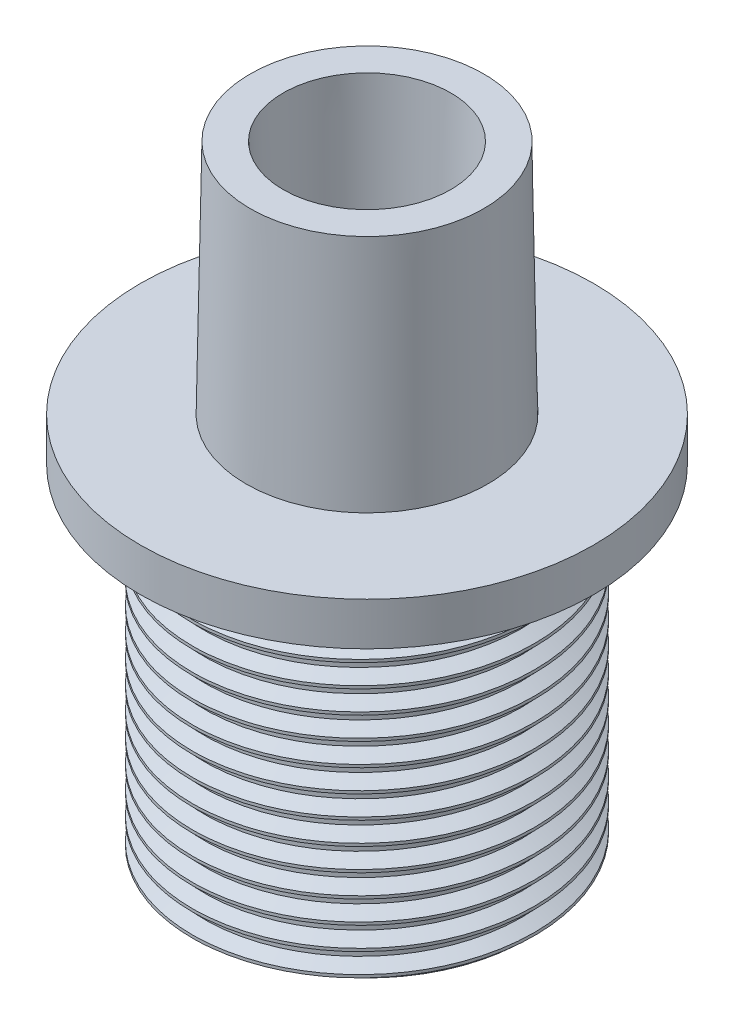
from build123d import *

# Parameters (mm, degrees)
SKETCH1_R           = 15.9
BOSS_EXTRUDE1_DEPTH = 35
SKETCH2_R           = 11.65
CUT_EXTRUDE1_DEPTH  = 25
BOSS_EXTRUDE2_START = -4
SKETCH5_R           = 21.087839895
SKETCH5_R_2         = 15.9
BOSS_EXTRUDE2_DEPTH = 4
THREAD1_PITCH       = 2.116666667
SKETCH3_R           = 11.25
BOSS_EXTRUDE3_DEPTH = 22
BOSS_EXTRUDE3_TAPER = 1
SKETCH7_R           = 7.8
CUT_EXTRUDE2_DEPTH  = 32
CUT_EXTRUDE2_DRAFT  = -1.5


with BuildPart() as part:
    # Sketch1 → Boss-Extrude1 (new body)
    with BuildSketch(Plane(origin=(0, 0, 0), x_dir=(1, 0, 0), z_dir=(0, 1, 0))):
        with Locations(Location((0, 0, 0), (0, 0, 270))):
            Circle(SKETCH1_R)
    extrude(amount=BOSS_EXTRUDE1_DEPTH)

    # Sketch2 → Cut-Extrude1 (cut)
    with BuildSketch(Plane.XZ):
        with Locations(Location((0, 0, 0), (0, 0, 270))):
            Circle(SKETCH2_R)
    extrude(amount=-CUT_EXTRUDE1_DEPTH, mode=Mode.SUBTRACT)

    # Sketch5 → Boss-Extrude2 (add)
    with BuildSketch(Plane(origin=(0, 35, 0), x_dir=(1, 0, 0), z_dir=(0, 1, 0)).offset(BOSS_EXTRUDE2_START)):
        with Locations(Location((0, 0, 0), (0, 0, 270))):
            Circle(SKETCH5_R)
        with Locations(Location((0, 0, 0), (0, 0, 270))):
            Circle(SKETCH5_R_2, mode=Mode.SUBTRACT)
    extrude(amount=BOSS_EXTRUDE2_DEPTH)

    # Thread1: the profile of Thread Profile1 profile screwed along a right-hand helix of 16.062992 turns, 10 arcs to a turn; built about Z, then put on its axis
    thread1_z = Axis((0, 0, 0), (0, 0, 1))
    thread1_corners = [(15.9003, 0, -0.000173205), (15.9003, 0, 1.852256533), (14.754320565, 0, 1.190624997), (14.754320565, 0, 0.66145833)]
    with BuildLine(mode=Mode.PRIVATE) as thread1_profile:
        Line(thread1_corners[0], thread1_corners[1])
        Line(thread1_corners[1], thread1_corners[2])
        Line(thread1_corners[2], thread1_corners[3])
        Line(thread1_corners[3], thread1_corners[0])
    thread1_cap = Face(thread1_profile.wire())
    thread1_turn_angles = [0, 18, 36, 54, 72, 90, 108, 126, 144, 162, 180, 198, 216, 234, 252, 270, 288, 306, 324, 342, 360]
    thread1_turn_weights = [1, 0.9510565162951535, 1, 0.9510565162951535, 1, 0.9510565162951535, 1, 0.9510565162951535, 1, 0.9510565162951535, 1, 0.9510565162951535, 1, 0.9510565162951535, 1, 0.9510565162951535, 1, 0.9510565162951535, 1, 0.9510565162951535, 1]
    thread1_turn_rails = [Edge.make_bspline([Vector(p[0], p[1], 0).rotate(thread1_z, thread1_turn_angles[k]) / thread1_turn_weights[k] + Vector(0, 0, p[2] + THREAD1_PITCH * thread1_turn_angles[k] / 360) for k in range(21)], [0, 0, 0, 1, 1, 2, 2, 3, 3, 4, 4, 5, 5, 6, 6, 7, 7, 8, 8, 9, 9, 10, 10, 10], 2, thread1_turn_weights) for p in thread1_corners]
    thread1_turn_sides = [Face.make_surface_from_curves(thread1_turn_rails[p[0]], thread1_turn_rails[p[1]]) for p in [(0, 1), (1, 2), (2, 3), (3, 0)]]
    thread1_last_angles = [5760, 5771.338582677, 5782.677165354]
    thread1_last_weights = [1, 0.9804824871166232, 1]
    thread1_last_rails = [Edge.make_bspline([Vector(p[0], p[1], 0).rotate(thread1_z, thread1_last_angles[k]) / thread1_last_weights[k] + Vector(0, 0, p[2] + THREAD1_PITCH * thread1_last_angles[k] / 360) for k in range(3)], [0, 0, 0, 1, 1, 1], 2, thread1_last_weights) for p in thread1_corners]
    thread1_last_sides = [Face.make_surface_from_curves(thread1_last_rails[p[0]], thread1_last_rails[p[1]]) for p in [(0, 1), (1, 2), (2, 3), (3, 0)]]
    thread1 = Plane(origin=(0, -5, 0), x_dir=(1, 0, 0), z_dir=(0, 1, 0)) * Solid(Shell([*[p.moved(Location((0, 0, THREAD1_PITCH * i))) for i in range(16) for p in thread1_turn_sides], *thread1_last_sides, thread1_cap, thread1_cap.rotate(thread1_z, 5782.677165354).moved(Location((0, 0, THREAD1_PITCH * 5782.677165354 / 360)))]))
    add(thread1, mode=Mode.SUBTRACT)

    # Sketch3 → Boss-Extrude3 (add)
    with BuildSketch(Plane(origin=(0, 35, 0), x_dir=(1, 0, 0), z_dir=(0, 1, 0))):
        Circle(SKETCH3_R)
    extrude(amount=BOSS_EXTRUDE3_DEPTH, taper=BOSS_EXTRUDE3_TAPER)


with BuildPart() as cut_extrude2_tool:
    # Sketch7 → Cut-Extrude2 (with draft: the straight prism first)
    with BuildSketch(Plane(origin=(0, 57, 0), x_dir=(1, 0, 0), z_dir=(0, 1, 0))):
        Circle(SKETCH7_R)
    extrude(amount=-CUT_EXTRUDE2_DEPTH)
    # Cut-Extrude2: the draft: its side faces are tilted about the plane it starts from
    cut_extrude2_sides = [cut_extrude2_tool.faces().sort_by_distance(p)[0] for p in [
        (-7.8, 41, 0),
    ]]
    draft(cut_extrude2_sides, Plane(origin=(0, 57, 0), x_dir=(1, 0, 0), z_dir=(0, 1, 0)), CUT_EXTRUDE2_DRAFT)


with BuildPart() as part_1:
    add(part.part)

    # Cut-Extrude2: cut by cut_extrude2_tool
    add(cut_extrude2_tool.part, mode=Mode.SUBTRACT)


solid = part_1.part
